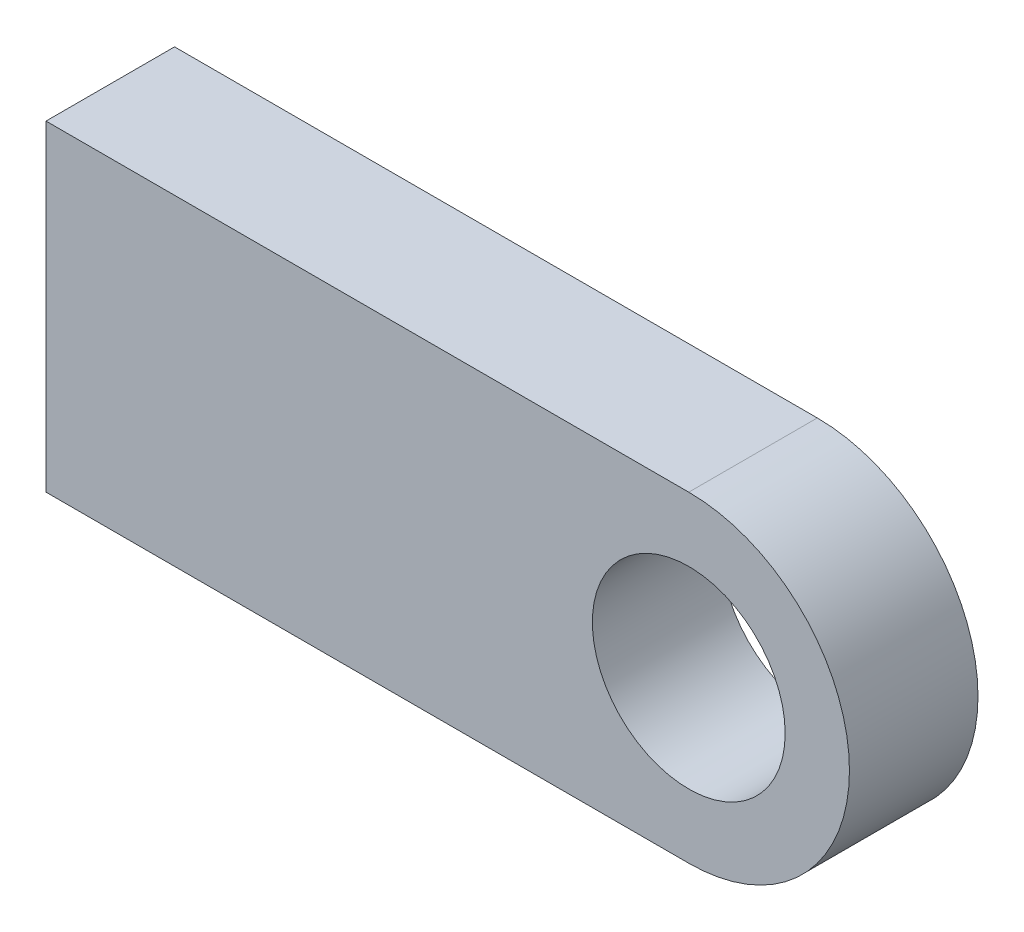
from build123d import *

# Parameters (mm, degrees)
SKETCH1_R           = 15
BOSS_EXTRUDE1_DEPTH = 20


with BuildPart() as part:
    # Sketch1 → Boss-Extrude1 (new body)
    with BuildSketch(Plane.XY):
        with BuildLine():
            Line((-95, -7.75), (5, -7.75))
            ThreePointArc((5, -7.75), (30, -32.75), (5, -57.75))
            Line((5, -57.75), (-95, -57.75))
            Line((-95, -57.75), (-95, -7.75))
        make_face()
        with Locations((5, -32.75)):
            Circle(SKETCH1_R, mode=Mode.SUBTRACT)
    extrude(amount=BOSS_EXTRUDE1_DEPTH)


solid = part.part
